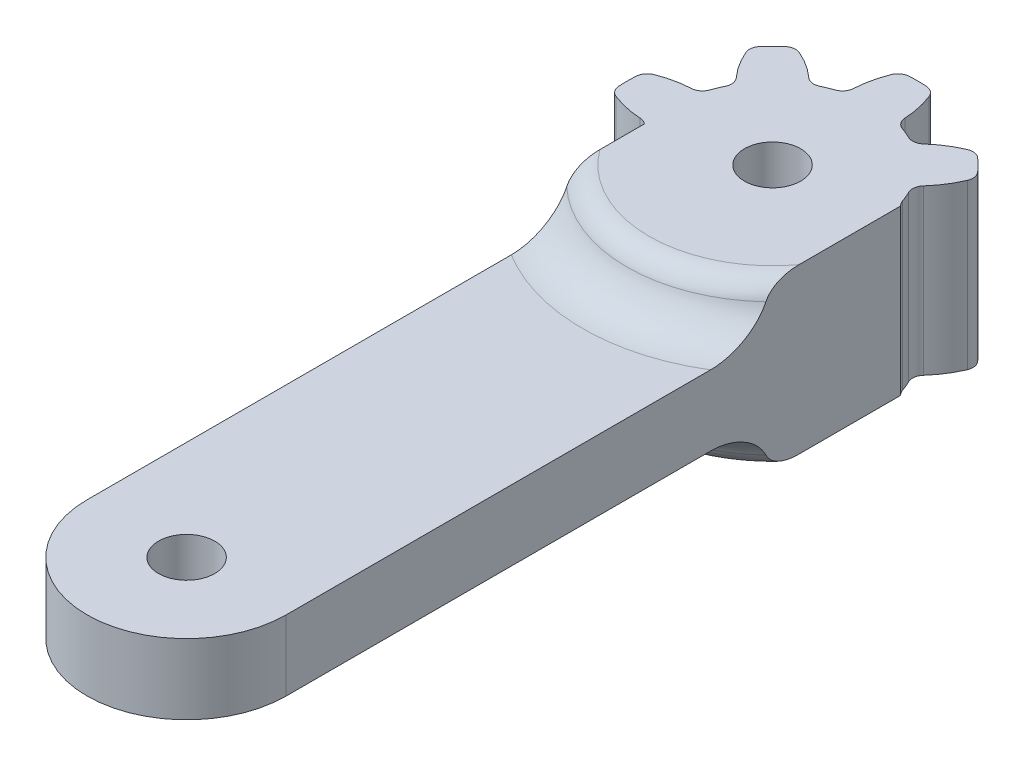
from build123d import *

# Parameters (mm, degrees)
BOSS_EXTRUDE1_DEPTH = 7
BOSS_EXTRUDE2_DEPTH = 7
SKETCH3_R           = 1.2
SKETCH3_W           = 3
SKETCH3_H           = 6
SKETCH3_W_2         = 1
SKETCH3_H_2         = 1.756233336
CUT_EXTRUDE1_DEPTH  = 7
CUT_EXTRUDE2_DEPTH  = 2
CUT_EXTRUDE3_START  = -2
CUT_EXTRUDE3_DEPTH  = 2
FILLET1_R           = 2
FILLET2_R           = 1


with BuildPart() as part:
    # Sketch1 → Boss-Extrude1 (new body)
    with BuildSketch(Plane(origin=(0, 0, 0), x_dir=(1, 0, 0), z_dir=(0, 1, 0))):
        with BuildLine():
            ThreePointArc((-3.91606346, 1.893923699), (-4.018875966, 1.664672931), (-4.108281319, 1.429868737))
            ThreePointArc((-4.108281319, 1.429868737), (-4.280699455, 1.194070126), (-4.55544348, 1.094849567))
            ThreePointArc((-4.55544348, 1.094849567), (-5.227650928, 1.004963027), (-5.875844758, 0.805495733))
            ThreePointArc((-5.875844758, 0.805495733), (-6.095335918, 0.633837197), (-6.188868421, 0.371359211))
            ThreePointArc((-6.188868421, 0.371359211), (-6.2, 0), (-6.188868421, -0.371359211))
            ThreePointArc((-6.188868421, -0.371359211), (-6.095335918, -0.633837197), (-5.875844758, -0.805495733))
            ThreePointArc((-5.875844758, -0.805495733), (-5.227650928, -1.004963027), (-4.55544348, -1.094849567))
            ThreePointArc((-4.55544348, -1.094849567), (-4.280699455, -1.194070126), (-4.108281319, -1.429868737))
            ThreePointArc((-4.108281319, -1.429868737), (-4.018875966, -1.664672931), (-3.91606346, -1.893923699))
            ThreePointArc((-3.91606346, -1.893923699), (-3.871246696, -2.182576529), (-3.995360529, -2.447009422))
            ThreePointArc((-3.995360529, -2.447009422), (-4.407123592, -2.985891249), (-4.724421169, -3.585278179))
            ThreePointArc((-4.724421169, -3.585278179), (-4.758243941, -3.861862781), (-4.638781445, -4.113600212))
            ThreePointArc((-4.638781445, -4.113600212), (-4.274116248, -4.491317212), (-3.87880163, -4.836827257))
            ThreePointArc((-3.87880163, -4.836827257), (-3.119853719, -4.489348414), (-2.447009422, -3.995360529))
            ThreePointArc((-2.447009422, -3.995360529), (-2.182576529, -3.871246696), (-1.893923699, -3.91606346))
            ThreePointArc((-1.893923699, -3.91606346), (-1.664672931, -4.018875966), (-1.429868737, -4.108281319))
            ThreePointArc((-1.429868737, -4.108281319), (-1.194070126, -4.280699455), (-1.094849567, -4.55544348))
            ThreePointArc((-1.094849567, -4.55544348), (-1.004963027, -5.227650928), (-0.805495733, -5.875844758))
            ThreePointArc((-0.805495733, -5.875844758), (-0.633837197, -6.095335918), (-0.371359211, -6.188868421))
            ThreePointArc((-0.371359211, -6.188868421), (0, -6.2), (0.371359211, -6.188868421))
            ThreePointArc((0.371359211, -6.188868421), (0.633837197, -6.095335918), (0.805495733, -5.875844758))
            ThreePointArc((0.805495733, -5.875844758), (1.004963027, -5.227650928), (1.094849567, -4.55544348))
            ThreePointArc((1.094849567, -4.55544348), (1.194070126, -4.280699455), (1.429868737, -4.108281319))
            ThreePointArc((1.429868737, -4.108281319), (1.664672931, -4.018875966), (1.893923699, -3.91606346))
            ThreePointArc((1.893923699, -3.91606346), (2.182576529, -3.871246696), (2.447009422, -3.995360529))
            ThreePointArc((2.447009422, -3.995360529), (2.985891249, -4.407123592), (3.585278179, -4.724421169))
            ThreePointArc((3.585278179, -4.724421169), (3.861862781, -4.758243941), (4.113600212, -4.638781445))
            ThreePointArc((4.113600212, -4.638781445), (4.384062043, -4.384062043), (4.638781445, -4.113600212))
            ThreePointArc((4.638781445, -4.113600212), (4.758243941, -3.861862781), (4.724421169, -3.585278179))
            ThreePointArc((4.724421169, -3.585278179), (4.407123592, -2.985891249), (3.995360529, -2.447009422))
            ThreePointArc((3.995360529, -2.447009422), (3.871246696, -2.182576529), (3.91606346, -1.893923699))
            ThreePointArc((3.91606346, -1.893923699), (4.018875966, -1.664672931), (4.108281319, -1.429868737))
            ThreePointArc((4.108281319, -1.429868737), (4.280699455, -1.194070126), (4.55544348, -1.094849567))
            ThreePointArc((4.55544348, -1.094849567), (5.227650928, -1.004963027), (5.875844758, -0.805495733))
            ThreePointArc((5.875844758, -0.805495733), (6.095335918, -0.633837197), (6.188868421, -0.371359211))
            ThreePointArc((6.188868421, -0.371359211), (6.2, 0), (6.188868421, 0.371359211))
            ThreePointArc((6.188868421, 0.371359211), (6.095335918, 0.633837197), (5.875844758, 0.805495733))
            ThreePointArc((5.875844758, 0.805495733), (5.227650928, 1.004963027), (4.55544348, 1.094849567))
            ThreePointArc((4.55544348, 1.094849567), (4.280699455, 1.194070126), (4.108281319, 1.429868737))
            ThreePointArc((4.108281319, 1.429868737), (4.018875966, 1.664672931), (3.91606346, 1.893923699))
            ThreePointArc((3.91606346, 1.893923699), (3.871246696, 2.182576529), (3.995360529, 2.447009422))
            ThreePointArc((3.995360529, 2.447009422), (4.407123592, 2.985891249), (4.724421169, 3.585278179))
            ThreePointArc((4.724421169, 3.585278179), (4.758243941, 3.861862781), (4.638781445, 4.113600212))
            ThreePointArc((4.638781445, 4.113600212), (4.384062043, 4.384062043), (4.113600212, 4.638781445))
            ThreePointArc((4.113600212, 4.638781445), (3.861862781, 4.758243941), (3.585278179, 4.724421169))
            ThreePointArc((3.585278179, 4.724421169), (2.985891249, 4.407123592), (2.447009422, 3.995360529))
            ThreePointArc((2.447009422, 3.995360529), (2.182576529, 3.871246696), (1.893923699, 3.91606346))
            ThreePointArc((1.893923699, 3.91606346), (1.664672931, 4.018875966), (1.429868737, 4.108281319))
            ThreePointArc((1.429868737, 4.108281319), (1.194070126, 4.280699455), (1.094849567, 4.55544348))
            ThreePointArc((1.094849567, 4.55544348), (1.004963027, 5.227650928), (0.805495733, 5.875844758))
            ThreePointArc((0.805495733, 5.875844758), (0.633837197, 6.095335918), (0.371359211, 6.188868421))
            ThreePointArc((0.371359211, 6.188868421), (0, 6.2), (-0.371359211, 6.188868421))
            ThreePointArc((-0.371359211, 6.188868421), (-0.633837197, 6.095335918), (-0.805495733, 5.875844758))
            ThreePointArc((-0.805495733, 5.875844758), (-1.004963027, 5.227650928), (-1.094849567, 4.55544348))
            ThreePointArc((-1.094849567, 4.55544348), (-1.194070126, 4.280699455), (-1.429868737, 4.108281319))
            ThreePointArc((-1.429868737, 4.108281319), (-1.664672931, 4.018875966), (-1.893923699, 3.91606346))
            ThreePointArc((-1.893923699, 3.91606346), (-2.182576529, 3.871246696), (-2.447009422, 3.995360529))
            ThreePointArc((-2.447009422, 3.995360529), (-2.985891249, 4.407123592), (-3.585278179, 4.724421169))
            ThreePointArc((-3.585278179, 4.724421169), (-3.861862781, 4.758243941), (-4.113600212, 4.638781445))
            ThreePointArc((-4.113600212, 4.638781445), (-4.384062043, 4.384062043), (-4.638781445, 4.113600212))
            ThreePointArc((-4.638781445, 4.113600212), (-4.758243941, 3.861862781), (-4.724421169, 3.585278179))
            ThreePointArc((-4.724421169, 3.585278179), (-4.407123592, 2.985891249), (-3.995360529, 2.447009422))
            ThreePointArc((-3.995360529, 2.447009422), (-3.871246696, 2.182576529), (-3.91606346, 1.893923699))
        make_face()
    extrude(amount=BOSS_EXTRUDE1_DEPTH)

    # Sketch2 → Boss-Extrude2 (add)
    with BuildSketch(Plane(origin=(0, 7, 0), x_dir=(1, 0, 0), z_dir=(0, 1, 0))):
        with BuildLine():
            Line((4.25, 0), (4.25, -25))
            ThreePointArc((4.25, -25), (0, -29.25), (-4.25, -25))
            Line((-4.25, -25), (-4.25, 0))
            ThreePointArc((-4.25, 0), (0, 4.25), (4.25, 0))
        make_face()
    extrude(amount=-BOSS_EXTRUDE2_DEPTH)

    # Sketch3 → Cut-Extrude1 (cut)
    with BuildSketch(Plane(origin=(0, 7, 0), x_dir=(1, 0, 0), z_dir=(0, 1, 0))):
        with Locations(Location((0, 0, 0), (0, 0, 270))):
            Circle(SKETCH3_R)
        with Locations(Location((0, -25, 0), (0, 0, 270))):
            Circle(SKETCH3_R)
        with Locations((5.75, -1.514144437)):
            Rectangle(SKETCH3_W, SKETCH3_H)
        with Locations((-4.75, -3.636027769)):
            Rectangle(SKETCH3_W_2, SKETCH3_H_2)
    extrude(amount=-CUT_EXTRUDE1_DEPTH, mode=Mode.SUBTRACT)

    # Sketch5 → Cut-Extrude2 (cut)
    with BuildSketch(Plane.XZ):
        with BuildLine():
            Line((-4.25, 4.375785644), (-4.25, 29.25))
            Line((-4.25, 29.25), (4.25, 29.25))
            Line((4.25, 29.25), (4.25, 4.375785644))
            ThreePointArc((4.25, 4.375785644), (0, 6.1), (-4.25, 4.375785644))
        make_face()
    extrude(amount=-CUT_EXTRUDE2_DEPTH, mode=Mode.SUBTRACT)

    # Sketch6 → Cut-Extrude3 (cut)
    with BuildSketch(Plane(origin=(0, 7, 0), x_dir=(1, 0, 0), z_dir=(0, 1, 0)).offset(CUT_EXTRUDE3_START)):
        with BuildLine():
            Line((-4.25, -4.375785644), (-4.25, -29.25))
            Line((-4.25, -29.25), (4.25, -29.25))
            Line((4.25, -29.25), (4.25, -4.375785644))
            ThreePointArc((4.25, -4.375785644), (0, -6.1), (-4.25, -4.375785644))
        make_face()
    extrude(amount=CUT_EXTRUDE3_DEPTH, mode=Mode.SUBTRACT)

    # Fillet1
    fillet1_edges = [part.edges().sort_by_distance(p)[0] for p in [
        (0, 2, 6.1),
        (0, 5, 6.1),
    ]]
    fillet(fillet1_edges, radius=FILLET1_R - 0.0001)  # a hair under: the kernel refuses the full size

    # Fillet2
    fillet2_edges = [part.edges().sort_by_distance(p)[0] for p in [
        (0, 7, 6.1),
        (0, 0, 6.1),
    ]]
    fillet(fillet2_edges, radius=FILLET2_R)


solid = part.part
